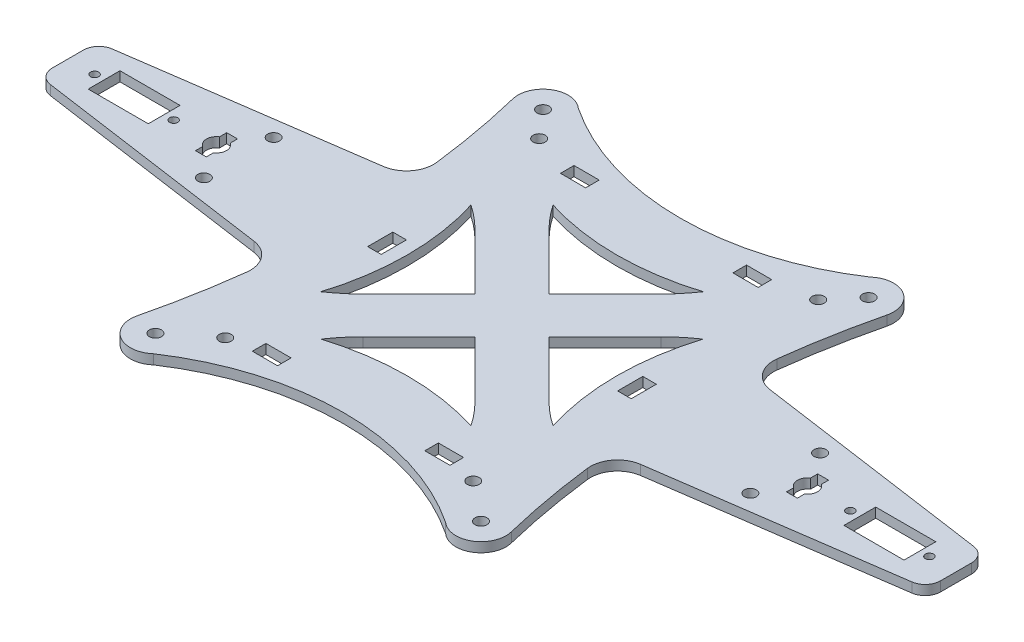
from build123d import *

# Parameters (mm, degrees)
SKETCH_1_R      = 1.55
SKETCH_1_R_2    = 1.05
SKETCH_1_W      = 6.5
SKETCH_1_H      = 3.5
SKETCH_1_W_2    = 3.5
SKETCH_1_H_2    = 6.5
SKETCH_1_W_3    = 15.5
SKETCH_1_H_3    = 8.2
EXTRUDE_1_DEPTH = 2.5
FILLET_1_R      = 4
FILLET_2_R      = 7


with BuildPart() as part:
    # 草图1 → 凸台-拉伸1 (new body)
    with BuildSketch(Plane(origin=(0, 0, 0), x_dir=(1, 0, 0), z_dir=(0, 1, 0))):
        with BuildLine():
            Line((114.591143215, 7.468307572), (114.591143215, -7.468307572))
            Line((114.591143215, -7.468307572), (43.193640968, -17.646273029))
            ThreePointArc((43.193640968, -17.646273029), (45.143245402, -33.15226541), (48.27557779, -48.463217404))
            ThreePointArc((48.27557779, -48.463217404), (45.335063646, -55.533708325), (37.709796983, -54.831018053))
            ThreePointArc((37.709796983, -54.831018053), (0, -43.436211003), (-37.709796983, -54.831018053))
            ThreePointArc((-37.709796983, -54.831018053), (-45.335063646, -55.533708325), (-48.27557779, -48.463217404))
            ThreePointArc((-48.27557779, -48.463217404), (-45.143245402, -33.15226541), (-43.193640968, -17.646273029))
            Line((-43.193640968, -17.646273029), (-114.591143215, -7.468307572))
            Line((-114.591143215, -7.468307572), (-114.591143215, 7.468307572))
            Line((-114.591143215, 7.468307572), (-43.193640968, 17.646273029))
            ThreePointArc((-43.193640968, 17.646273029), (-45.143245402, 33.15226541), (-48.27557779, 48.463217404))
            ThreePointArc((-48.27557779, 48.463217404), (-45.335063646, 55.533708325), (-37.709796983, 54.831018053))
            ThreePointArc((-37.709796983, 54.831018053), (0, 43.436211003), (37.709796983, 54.831018053))
            ThreePointArc((37.709796983, 54.831018053), (45.335063646, 55.533708325), (48.27557779, 48.463217404))
            ThreePointArc((48.27557779, 48.463217404), (45.143245402, 33.15226541), (43.193640968, 17.646273029))
            Line((43.193640968, 17.646273029), (114.591143215, 7.468307572))
        make_face()
        with Locations((-36, 43)):
            Circle(SKETCH_1_R, mode=Mode.SUBTRACT)
        with Locations((-32, -42)):
            Circle(SKETCH_1_R, mode=Mode.SUBTRACT)
        with Locations((32, -42)):
            Circle(SKETCH_1_R, mode=Mode.SUBTRACT)
        with Locations((36, 43)):
            Circle(SKETCH_1_R, mode=Mode.SUBTRACT)
        with Locations((42, 50)):
            Circle(SKETCH_1_R, mode=Mode.SUBTRACT)
        with Locations((42, -50)):
            Circle(SKETCH_1_R, mode=Mode.SUBTRACT)
        with Locations((-42, -50)):
            Circle(SKETCH_1_R, mode=Mode.SUBTRACT)
        with Locations((-42, 50)):
            Circle(SKETCH_1_R, mode=Mode.SUBTRACT)
        with Locations((107.7, 0)):
            Circle(SKETCH_1_R_2, mode=Mode.SUBTRACT)
        with Locations((87.3, 0)):
            Circle(SKETCH_1_R_2, mode=Mode.SUBTRACT)
        with Locations((-87.3, 0)):
            Circle(SKETCH_1_R_2, mode=Mode.SUBTRACT)
        with Locations((-107.7, 0)):
            Circle(SKETCH_1_R_2, mode=Mode.SUBTRACT)
        with Locations((70.5, 9)):
            Circle(SKETCH_1_R, mode=Mode.SUBTRACT)
        with Locations((70.5, -9)):
            Circle(SKETCH_1_R, mode=Mode.SUBTRACT)
        with Locations((-70.5, -9)):
            Circle(SKETCH_1_R, mode=Mode.SUBTRACT)
        with Locations((-70.5, 9)):
            Circle(SKETCH_1_R, mode=Mode.SUBTRACT)
        with Locations((-22.25, 39.75)):
            Rectangle(SKETCH_1_W, SKETCH_1_H, mode=Mode.SUBTRACT)
        with Locations((-32.25, 0)):
            Rectangle(SKETCH_1_W_2, SKETCH_1_H_2, mode=Mode.SUBTRACT)
        with Locations((-22.25, -39.75)):
            Rectangle(SKETCH_1_W, SKETCH_1_H, mode=Mode.SUBTRACT)
        with Locations((22.25, 39.75)):
            Rectangle(SKETCH_1_W, SKETCH_1_H, mode=Mode.SUBTRACT)
        with Locations((22.25, -39.75)):
            Rectangle(SKETCH_1_W, SKETCH_1_H, mode=Mode.SUBTRACT)
        with Locations((32.25, 0)):
            Rectangle(SKETCH_1_W_2, SKETCH_1_H_2, mode=Mode.SUBTRACT)
        with BuildLine():
            Line((77.65, -2.176778405), (77.65, -4.025))
            Line((77.65, -4.025), (74.85, -4.025))
            Line((74.85, -4.025), (74.85, -2.176778405))
            ThreePointArc((74.85, -2.176778405), (73.661880176, 0), (74.85, 2.176778405))
            Line((74.85, 2.176778405), (74.85, 4.025))
            Line((74.85, 4.025), (77.65, 4.025))
            Line((77.65, 4.025), (77.65, 2.176778405))
            ThreePointArc((77.65, 2.176778405), (78.838119824, 0), (77.65, -2.176778405))
        make_face(mode=Mode.SUBTRACT)
        with Locations((97.5, 0)):
            Rectangle(SKETCH_1_W_3, SKETCH_1_H_3, mode=Mode.SUBTRACT)
        with Locations((-97.5, 0)):
            Rectangle(SKETCH_1_W_3, SKETCH_1_H_3, mode=Mode.SUBTRACT)
        with BuildLine():
            Line((-74.85, -2.176778405), (-74.85, -4.025))
            Line((-74.85, -4.025), (-77.65, -4.025))
            Line((-77.65, -4.025), (-77.65, -2.176778405))
            ThreePointArc((-77.65, -2.176778405), (-78.838119824, 0), (-77.65, 2.176778405))
            Line((-77.65, 2.176778405), (-77.65, 4.025))
            Line((-77.65, 4.025), (-74.85, 4.025))
            Line((-74.85, 4.025), (-74.85, 2.176778405))
            ThreePointArc((-74.85, 2.176778405), (-73.661880176, 0), (-74.85, -2.176778405))
        make_face(mode=Mode.SUBTRACT)
        with BuildLine():
            Line((-23.978041684, 14.429581723), (-9.54845996, 0))
            Line((-9.54845996, 0), (-23.978041684, -14.429581723))
            ThreePointArc((-23.978041684, -14.429581723), (-26.851664039, -17.042325553), (-29.960234119, -19.370614155))
            ThreePointArc((-29.960234119, -19.370614155), (-27.006361348, 0), (-29.960234119, 19.370614155))
            ThreePointArc((-29.960234119, 19.370614155), (-26.851664039, 17.042325553), (-23.978041684, 14.429581723))
        make_face(mode=Mode.SUBTRACT)
        with BuildLine():
            Line((14.429581723, 23.978041684), (0, 9.54845996))
            Line((0, 9.54845996), (-14.429581723, 23.978041684))
            ThreePointArc((-14.429581723, 23.978041684), (-17.042325553, 26.851664039), (-19.370614155, 29.960234119))
            ThreePointArc((-19.370614155, 29.960234119), (0, 27.006361348), (19.370614155, 29.960234119))
            ThreePointArc((19.370614155, 29.960234119), (17.042325553, 26.851664039), (14.429581723, 23.978041684))
        make_face(mode=Mode.SUBTRACT)
        with BuildLine():
            Line((23.978041684, -14.429581723), (9.54845996, 0))
            Line((9.54845996, 0), (23.978041684, 14.429581723))
            ThreePointArc((23.978041684, 14.429581723), (26.851664039, 17.042325553), (29.960234119, 19.370614155))
            ThreePointArc((29.960234119, 19.370614155), (27.006361348, 0), (29.960234119, -19.370614155))
            ThreePointArc((29.960234119, -19.370614155), (26.851664039, -17.042325553), (23.978041684, -14.429581723))
        make_face(mode=Mode.SUBTRACT)
        with BuildLine():
            Line((-14.429581723, -23.978041684), (0, -9.54845996))
            Line((0, -9.54845996), (14.429581723, -23.978041684))
            ThreePointArc((14.429581723, -23.978041684), (17.042325553, -26.851664039), (19.370614155, -29.960234119))
            ThreePointArc((19.370614155, -29.960234119), (0, -27.006361348), (-19.370614155, -29.960234119))
            ThreePointArc((-19.370614155, -29.960234119), (-17.042325553, -26.851664039), (-14.429581723, -23.978041684))
        make_face(mode=Mode.SUBTRACT)
    extrude(amount=EXTRUDE_1_DEPTH)

    # 圆角1
    fillet_1_edges = [part.edges().sort_by_distance(p)[0] for p in [
        (114.591143215, 1.25, -7.468307572),
        (114.591143215, 1.25, 7.468307572),
        (-114.591143215, 1.25, -7.468307572),
        (-114.591143215, 1.25, 7.468307572),
    ]]
    fillet(fillet_1_edges, radius=FILLET_1_R)

    # 圆角2
    fillet_2_edges = [part.edges().sort_by_distance(p)[0] for p in [
        (-43.193640968, 1.25, -17.646273029),
        (43.193640968, 1.25, -17.646273029),
        (43.193640968, 1.25, 17.646273029),
        (-43.193640968, 1.25, 17.646273029),
    ]]
    fillet(fillet_2_edges, radius=FILLET_2_R)


solid = part.part
